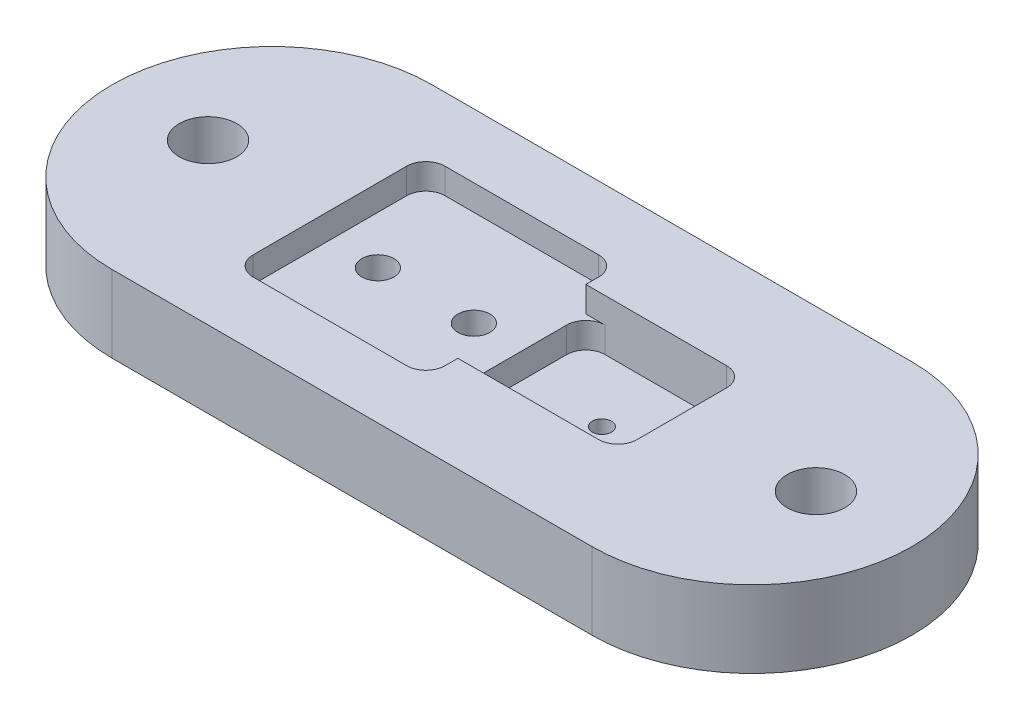
from build123d import *

# Parameters (mm, degrees)
BOSS_EXTRUDE1_DEPTH = 12
SKETCH2_R           = 4.5
CUT_EXTRUDE1_DEPTH  = 113.445542375
SKETCH3_W           = 30
SKETCH3_H           = 30
CUT_EXTRUDE2_DEPTH  = 4
SKETCH4_W           = 25
SKETCH4_H           = 20
CUT_EXTRUDE3_DEPTH  = 8
FILLET1_R           = 3
SKETCH5_R           = 1.5
CUT_EXTRUDE4_DEPTH  = 113.089250154
SKETCH6_R           = 2.5
CUT_EXTRUDE5_DEPTH  = 113.089250154


with BuildPart() as part:
    # Sketch1 → Boss-Extrude1 (new body)
    with BuildSketch(Plane(origin=(0, 0, 0), x_dir=(1, 0, 0), z_dir=(0, 1, 0))):
        with BuildLine():
            Line((75, 50), (0, 50))
            ThreePointArc((0, 50), (-25, 25), (0, 0))
            Line((0, 0), (75, 0))
            ThreePointArc((75, 0), (100, 25), (75, 50))
        make_face()
    extrude(amount=BOSS_EXTRUDE1_DEPTH)

    # Sketch2 → Cut-Extrude1 (cut, through all)
    with BuildSketch(Plane(origin=(0, 12, 0), x_dir=(1, 0, 0), z_dir=(0, 1, 0))):
        with Locations((-10, 25)):
            Circle(SKETCH2_R)
        with Locations((85, 25)):
            Circle(SKETCH2_R)
    extrude(amount=-CUT_EXTRUDE1_DEPTH, mode=Mode.SUBTRACT)

    # Sketch3 → Cut-Extrude2 (cut)
    with BuildSketch(Plane(origin=(0, 12, 0), x_dir=(1, 0, 0), z_dir=(0, 1, 0))):
        with Locations((24.041436108, 25)):
            Rectangle(SKETCH3_W, SKETCH3_H)
    extrude(amount=-CUT_EXTRUDE2_DEPTH, mode=Mode.SUBTRACT)

    # Sketch4 → Cut-Extrude3 (cut)
    with BuildSketch(Plane(origin=(0, 12, 0), x_dir=(1, 0, 0), z_dir=(0, 1, 0))):
        with Locations((51.541436108, 25)):
            Rectangle(SKETCH4_W, SKETCH4_H)
    extrude(amount=-CUT_EXTRUDE3_DEPTH, mode=Mode.SUBTRACT)

    # Fillet1
    fillet1_edges = [part.edges().sort_by_distance(p)[0] for p in [
        (39.041436108, 6, -35),
        (39.041436108, 6, -15),
        (64.041436108, 8, -15),
        (64.041436108, 8, -35),
        (39.041436108, 10, -10),
        (9.041436108, 10, -10),
        (9.041436108, 10, -40),
        (39.041436108, 10, -40),
    ]]
    fillet(fillet1_edges, radius=FILLET1_R)

    # Sketch5 → Cut-Extrude4 (cut, through all)
    with BuildSketch(Plane(origin=(0, 4, 0), x_dir=(1, 0, 0), z_dir=(0, 1, 0))):
        with Locations((51.541436108, 25)):
            Circle(SKETCH5_R)
    extrude(amount=-CUT_EXTRUDE4_DEPTH, mode=Mode.SUBTRACT)

    # Sketch6 → Cut-Extrude5 (cut, through all)
    with BuildSketch(Plane(origin=(0, 8, 0), x_dir=(1, 0, 0), z_dir=(0, 1, 0))):
        with Locations((16.541436108, 25)):
            Circle(SKETCH6_R)
        with Locations((31.541436108, 25)):
            Circle(SKETCH6_R)
    extrude(amount=-CUT_EXTRUDE5_DEPTH, mode=Mode.SUBTRACT)


solid = part.part
